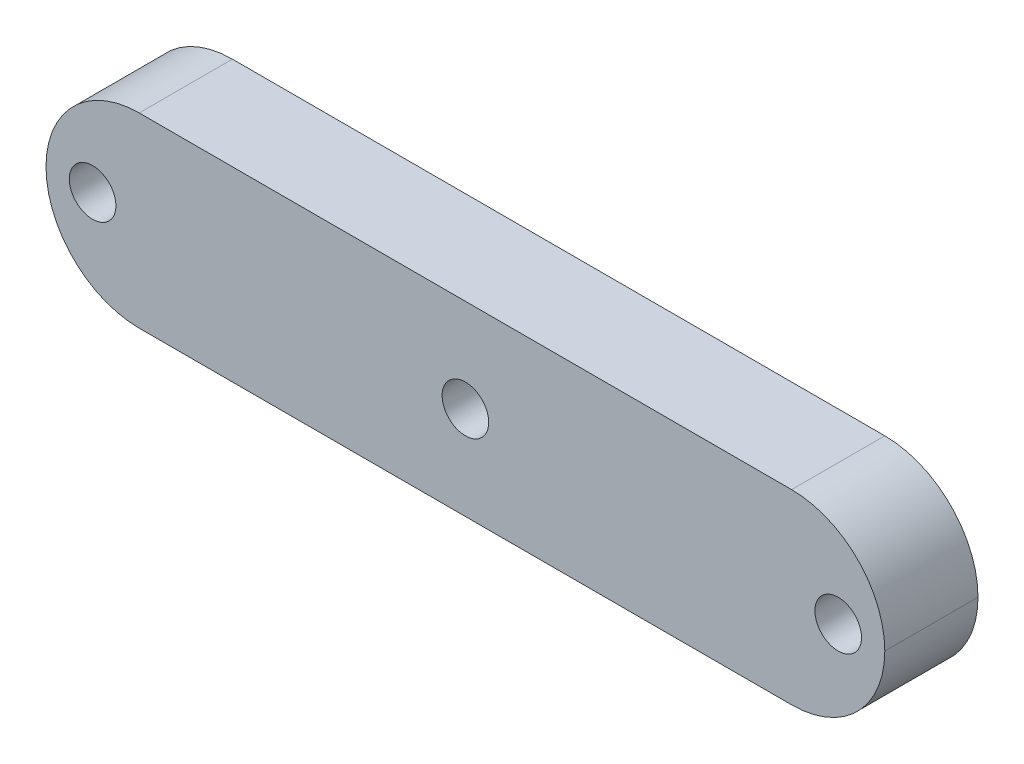
from build123d import *

# Parameters (mm, degrees)
SKETCH1_W           = 90
SKETCH1_H           = 20
SKETCH1_R           = 2.5
BOSS_EXTRUDE1_DEPTH = 10
FILLET1_R           = 10


with BuildPart() as part:
    # Sketch1 → Boss-Extrude1 (new body)
    with BuildSketch(Plane.XY):
        Rectangle(SKETCH1_W, SKETCH1_H)
        with Locations((-40, 0.116382556)):
            Circle(SKETCH1_R, mode=Mode.SUBTRACT)
        with Locations((40, 0)):
            Circle(SKETCH1_R, mode=Mode.SUBTRACT)
        Circle(SKETCH1_R, mode=Mode.SUBTRACT)
    extrude(amount=BOSS_EXTRUDE1_DEPTH)

    # Fillet1
    fillet1_edges = [part.edges().sort_by_distance(p)[0] for p in [
        (45, -10, 5),
        (45, 10, 5),
        (-45, -10, 5),
        (-45, 10, 5),
    ]]
    fillet(fillet1_edges, radius=FILLET1_R - 0.0001)  # a hair under: the kernel refuses the full size


solid = part.part
